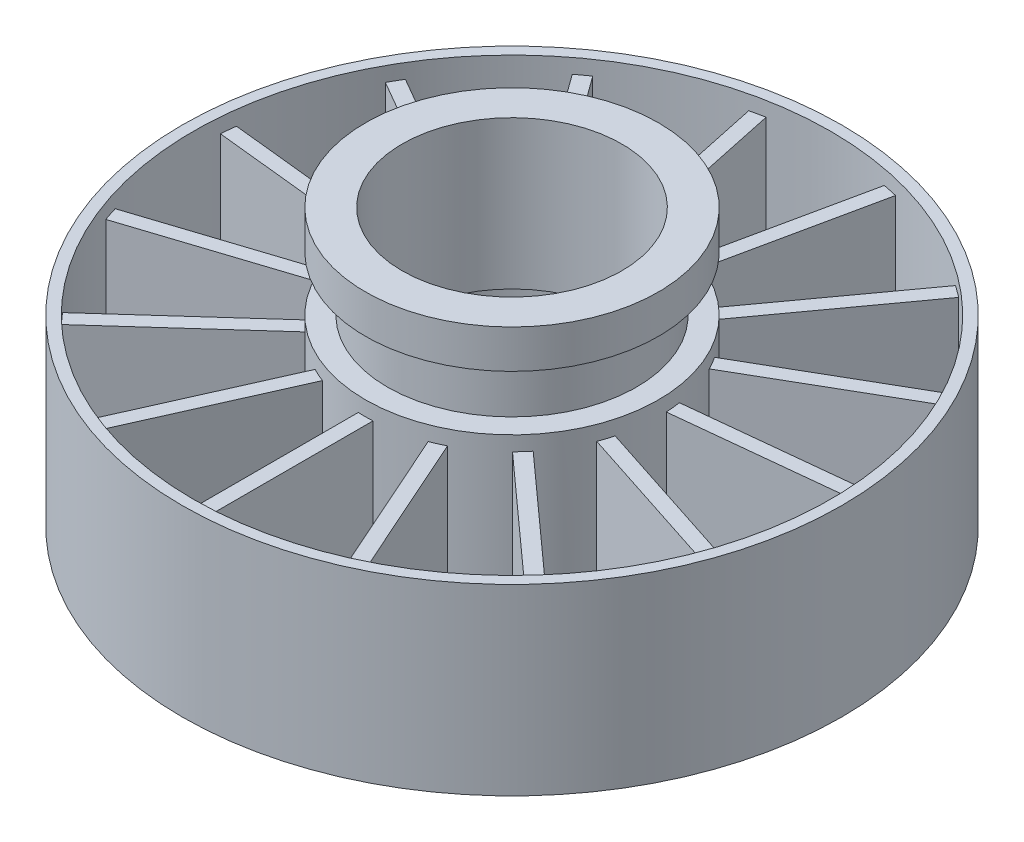
from build123d import *
from build123d.topology import SkipClean

# Parameters (mm, degrees)
SKETCH1_R                = 90
BOSS_EXTRUDE1_DEPTH      = 50
CUT_EXTRUDE1_DEPTH       = 50
SKETCH4_R                = 40
CUT_EXTRUDE2_DEPTH       = 137.546695512
SKETCH5_R                = 40
SKETCH5_R_2              = 34
BOSS_EXTRUDE2_DEPTH      = 50
BOSS_EXTRUDE3_DEPTH      = 15
BOSS_EXTRUDE3_DEPTH_BACK = 15
SKETCH9_R                = 34
SKETCH9_R_2              = 30
SKETCH10_R               = 40
SKETCH10_R_2             = 30
BOSS_EXTRUDE4_DEPTH      = 10.5
SKETCH11_R               = 90
SKETCH11_R_2             = 87
BOSS_EXTRUDE5_DEPTH      = 50
SKETCH12_R               = 87
SKETCH12_R_2             = 40
CUT_EXTRUDE3_DEPTH       = 4
SKETCH13_R               = 87
CUT_EXTRUDE4_DEPTH       = 4


with BuildPart() as part:
    # Sketch1 → Boss-Extrude1 (new body)
    with BuildSketch(Plane(origin=(0, 0, 0), x_dir=(1, 0, 0), z_dir=(0, 1, 0))):
        with Locations(Location((0, 0, 0), (0, 0, 270))):
            Circle(SKETCH1_R)
    extrude(amount=BOSS_EXTRUDE1_DEPTH)

    # Sketch2 → Cut-Extrude1 (cut)
    with BuildSketch(Plane.XZ):
        with BuildLine():
            Line((-2, 9.409260219), (-2, 89.977775034))
            ThreePointArc((-2, 89.977775034), (-18.712052174, 88.033284066), (-34.770167253, 83.012260957))
            Line((-34.770167253, 83.012260957), (-2, 9.409260219))
        make_face()
        with BuildLine():
            ThreePointArc((34.770167253, 83.012260957), (18.712052174, 88.033284066), (2, 89.977775034))
            Line((2, 89.977775034), (2, 9.409260219))
            Line((2, 9.409260219), (34.770167253, 83.012260957))
        make_face()
        with BuildLine():
            Line((-5.654181831, 7.782313647), (-38.424349084, 81.385314385))
            ThreePointArc((-38.424349084, 81.385314385), (-52.900672706, 72.811529494), (-65.528256711, 61.693172818))
            Line((-65.528256711, 61.693172818), (-5.654181831, 7.782313647))
        make_face()
        with BuildLine():
            ThreePointArc((65.528256711, 61.693172818), (52.900672706, 72.811529494), (38.424349084, 81.385314385))
            Line((38.424349084, 81.385314385), (5.654181831, 7.782313647))
            Line((5.654181831, 7.782313647), (65.528256711, 61.693172818))
        make_face()
        with BuildLine():
            Line((-8.330704256, 4.809734345), (-68.204779137, 58.720593516))
            ThreePointArc((-68.204779137, 58.720593516), (-77.942286341, 45), (-84.955915279, 29.706774634))
            Line((-84.955915279, 29.706774634), (-8.330704256, 4.809734345))
        make_face()
        with BuildLine():
            ThreePointArc((84.955915279, 29.706774634), (77.942286341, 45), (68.204779137, 58.720593516))
            Line((68.204779137, 58.720593516), (8.330704256, 4.809734345))
            Line((8.330704256, 4.809734345), (84.955915279, 29.706774634))
        make_face()
        with BuildLine():
            Line((-9.566772234, 1.00550828), (-86.191983256, 25.902548569))
            ThreePointArc((-86.191983256, 25.902548569), (-89.506970583, 9.407561694), (-89.693924294, -7.416194762))
            Line((-89.693924294, -7.416194762), (-9.566772234, 1.00550828))
        make_face()
        with BuildLine():
            ThreePointArc((89.693924294, -7.416194762), (89.506970583, 9.407561694), (86.191983256, 25.902548569))
            Line((86.191983256, 25.902548569), (9.566772234, 1.00550828))
            Line((9.566772234, 1.00550828), (89.693924294, -7.416194762))
        make_face()
        with BuildLine():
            Line((-9.14865838, -2.972579302), (-89.275810441, -11.394282343))
            ThreePointArc((-89.275810441, -11.394282343), (-85.595086467, -27.811529494), (-78.923038955, -43.256836709))
            Line((-78.923038955, -43.256836709), (-9.14865838, -2.972579302))
        make_face()
        with BuildLine():
            Line((89.275810441, -11.394282343), (9.14865838, -2.972579302))
            Line((9.14865838, -2.972579302), (78.923038955, -43.256836709))
            ThreePointArc((78.923038955, -43.256836709), (85.595086467, -27.811529494), (89.275810441, -11.394282343))
        make_face()
        with BuildLine():
            Line((-7.14865838, -6.436680917), (-76.923038955, -46.720938324))
            ThreePointArc((-76.923038955, -46.720938324), (-66.883034293, -60.221754572), (-54.505643188, -71.617978614))
            Line((-54.505643188, -71.617978614), (-7.14865838, -6.436680917))
        make_face()
        with BuildLine():
            Line((76.923038955, -46.720938324), (7.14865838, -6.436680917))
            Line((7.14865838, -6.436680917), (54.505643188, -71.617978614))
            ThreePointArc((54.505643188, -71.617978614), (66.883034293, -60.221754572), (76.923038955, -46.720938324))
        make_face()
        with BuildLine():
            Line((-3.912590403, -8.787821926), (-51.26957521, -73.969119623))
            ThreePointArc((-51.26957521, -73.969119623), (-36.606297877, -82.219091188), (-20.663726545, -87.595721387))
            Line((-20.663726545, -87.595721387), (-3.912590403, -8.787821926))
        make_face()
        with BuildLine():
            Line((51.26957521, -73.969119623), (3.912590403, -8.787821926))
            Line((3.912590403, -8.787821926), (20.663726545, -87.595721387))
            ThreePointArc((20.663726545, -87.595721387), (36.606297877, -82.219091188), (51.26957521, -73.969119623))
        make_face()
        with BuildLine():
            Line((0, -9.619468689), (-16.751136142, -88.42736815))
            ThreePointArc((-16.751136142, -88.42736815), (0, -90), (16.751136142, -88.42736815))
            Line((16.751136142, -88.42736815), (0, -9.619468689))
        make_face()
    extrude(amount=-CUT_EXTRUDE1_DEPTH, mode=Mode.SUBTRACT)

    # Sketch4 → Cut-Extrude2 (cut, through all)
    with BuildSketch(Plane(origin=(0, 50, 0), x_dir=(1, 0, 0), z_dir=(0, 1, 0))):
        Circle(SKETCH4_R)
    extrude(amount=-CUT_EXTRUDE2_DEPTH, mode=Mode.SUBTRACT)


with BuildPart() as cut_extrude2_piece_1:
    # of the separate pieces the step leaves, piece 1, a body of its own (cut_extrude2_pieces)
    add(part.part.solids().sort_by_distance((-84.955915279, 0, 29.706774634))[0])


with BuildPart() as cut_extrude2_piece_2:
    # of the separate pieces the step leaves, piece 2, a body of its own (cut_extrude2_pieces)
    add(part.part.solids().sort_by_distance((-65.528256711, 0, 61.693172818))[0])


with BuildPart() as cut_extrude2_piece_3:
    # of the separate pieces the step leaves, piece 3, a body of its own (cut_extrude2_pieces)
    add(part.part.solids().sort_by_distance((10.262360744, 0, -38.661142662))[0])


with BuildPart() as cut_extrude2_piece_4:
    # of the separate pieces the step leaves, piece 4, a body of its own (cut_extrude2_pieces)
    add(part.part.solids().sort_by_distance((14.422025249, 0, 37.309585735))[0])


with BuildPart() as cut_extrude2_piece_5:
    # of the separate pieces the step leaves, piece 5, a body of its own (cut_extrude2_pieces)
    add(part.part.solids().sort_by_distance((-2, 0, 89.977775034))[0])


with BuildPart() as cut_extrude2_piece_6:
    # of the separate pieces the step leaves, piece 6, a body of its own (cut_extrude2_pieces)
    add(part.part.solids().sort_by_distance((39.940175529, 0, -2.186865046))[0])


with BuildPart() as cut_extrude2_piece_7:
    # of the separate pieces the step leaves, piece 7, a body of its own (cut_extrude2_pieces)
    add(part.part.solids().sort_by_distance((25.100036427, 0, -31.144633107))[0])


with BuildPart() as cut_extrude2_piece_8:
    # of the separate pieces the step leaves, piece 8, a body of its own (cut_extrude2_pieces)
    add(part.part.solids().sort_by_distance((-34.770167253, 0, 83.012260957))[0])


with BuildPart() as cut_extrude2_piece_9:
    # of the separate pieces the step leaves, piece 9, a body of its own (cut_extrude2_pieces)
    add(part.part.solids().sort_by_distance((28.350351313, 0, 28.218036438))[0])


with BuildPart() as cut_extrude2_piece_10:
    # of the separate pieces the step leaves, piece 10, a body of its own (cut_extrude2_pieces)
    add(part.part.solids().sort_by_distance((-20.663726545, 0, -87.595721387))[0])


with BuildPart() as cut_extrude2_piece_11:
    # of the separate pieces the step leaves, piece 11, a body of its own (cut_extrude2_pieces)
    add(part.part.solids().sort_by_distance((-54.505643188, 0, -71.617978614))[0])


with BuildPart() as cut_extrude2_piece_12:
    # of the separate pieces the step leaves, piece 12, a body of its own (cut_extrude2_pieces)
    add(part.part.solids().sort_by_distance((37.37664408, 0, 14.247332289))[0])


with BuildPart() as cut_extrude2_piece_13:
    # of the separate pieces the step leaves, piece 13, a body of its own (cut_extrude2_pieces)
    add(part.part.solids().sort_by_distance((35.597687784, 0, -18.242933548))[0])


with BuildPart() as cut_extrude2_piece_14:
    # of the separate pieces the step leaves, piece 14, a body of its own (cut_extrude2_pieces)
    add(part.part.solids().sort_by_distance((-89.693924294, 0, -7.416194762))[0])


with BuildPart() as cut_extrude2_piece_15:
    # of the separate pieces the step leaves, piece 15, a body of its own (cut_extrude2_pieces)
    add(part.part.solids().sort_by_distance((-78.923038955, 0, -43.256836709))[0])


with BuildPart() as body_16:
    # Sketch5 → Boss-Extrude2 (new body)
    with BuildSketch(Plane(origin=(0, 50, 0), x_dir=(1, 0, 0), z_dir=(0, 1, 0))):
        with Locations(Location((0, 0, 0), (0, 0, 270))):
            Circle(SKETCH5_R)
        with Locations(Location((0, 0, 0), (0, 0, 270))):
            Circle(SKETCH5_R_2, mode=Mode.SUBTRACT)
    extrude(amount=-BOSS_EXTRUDE2_DEPTH)



with BuildPart() as body_17:
    # Sketch9 → Boss-Extrude3 (new, two sides: drawn at the far end of the back side and taken through both)
    with BuildSketch(Plane(origin=(0, 50, 0), x_dir=(1, 0, 0), z_dir=(0, 1, 0)).offset(-BOSS_EXTRUDE3_DEPTH_BACK)):
        with Locations(Location((0, 0, 0), (0, 0, 270))):
            Circle(SKETCH9_R)
        with Locations(Location((0, 0, 0), (0, 0, 270))):
            Circle(SKETCH9_R_2, mode=Mode.SUBTRACT)
    extrude(amount=BOSS_EXTRUDE3_DEPTH + BOSS_EXTRUDE3_DEPTH_BACK)

    # Sketch10 → Boss-Extrude4 (add)
    with BuildSketch(Plane(origin=(0, 65, 0), x_dir=(1, 0, 0), z_dir=(0, 1, 0))):
        with Locations(Location((0, 0, 0), (0, 0, 270))):
            Circle(SKETCH10_R)
        with Locations(Location((0, 0, 0), (0, 0, 270))):
            Circle(SKETCH10_R_2, mode=Mode.SUBTRACT)
    extrude(amount=BOSS_EXTRUDE4_DEPTH)


with BuildPart() as body_16_1:
    add(body_16.part)

    add(body_17.part)  # Boss-Extrude5 merges body 17

    add(cut_extrude2_piece_3.part)  # Boss-Extrude5 merges Cut-Extrude2 piece 3

    add(cut_extrude2_piece_7.part)  # Boss-Extrude5 merges Cut-Extrude2 piece 7

    add(cut_extrude2_piece_14.part)  # Boss-Extrude5 merges Cut-Extrude2 piece 14

    add(cut_extrude2_piece_15.part)  # Boss-Extrude5 merges Cut-Extrude2 piece 15

    add(cut_extrude2_piece_11.part)  # Boss-Extrude5 merges Cut-Extrude2 piece 11

    add(cut_extrude2_piece_5.part)  # Boss-Extrude5 merges Cut-Extrude2 piece 5

    add(cut_extrude2_piece_1.part)  # Boss-Extrude5 merges Cut-Extrude2 piece 1

    add(cut_extrude2_piece_8.part)  # Boss-Extrude5 merges Cut-Extrude2 piece 8

    add(cut_extrude2_piece_2.part)  # Boss-Extrude5 merges Cut-Extrude2 piece 2

    add(cut_extrude2_piece_13.part)  # Boss-Extrude5 merges Cut-Extrude2 piece 13

    add(cut_extrude2_piece_6.part)  # Boss-Extrude5 merges Cut-Extrude2 piece 6

    add(cut_extrude2_piece_4.part)  # Boss-Extrude5 merges Cut-Extrude2 piece 4

    add(cut_extrude2_piece_12.part)  # Boss-Extrude5 merges Cut-Extrude2 piece 12

    add(cut_extrude2_piece_9.part)  # Boss-Extrude5 merges Cut-Extrude2 piece 9

    add(cut_extrude2_piece_10.part)  # Boss-Extrude5 merges Cut-Extrude2 piece 10
    # Sketch11 → Boss-Extrude5 (add)
    with BuildSketch(Plane.XZ):
        with Locations(Location((0, 0, 0), (0, 0, 90))):
            Circle(SKETCH11_R)
        Circle(SKETCH11_R_2, mode=Mode.SUBTRACT)
    extrude(amount=-BOSS_EXTRUDE5_DEPTH)

    # Sketch12 → Cut-Extrude3 (cut)
    with SkipClean():  # the faces are left unmerged after this step: merging them gives an invalid solid
        with BuildSketch(Plane(origin=(0, 50, 0), x_dir=(1, 0, 0), z_dir=(0, 1, 0))):
            with Locations(Location((0, 0, 0), (0, 0, 100.682739604))):
                Circle(SKETCH12_R)
            with Locations(Location((0, 0, 0), (0, 0, 270))):
                Circle(SKETCH12_R_2, mode=Mode.SUBTRACT)
        extrude(amount=-CUT_EXTRUDE3_DEPTH, mode=Mode.SUBTRACT)
    add(body_16_1.part.scale(1), mode=Mode.REPLACE)  # the faces are merged on a copy

    # Sketch13 → Cut-Extrude4 (cut)
    with SkipClean():  # the faces are left unmerged after this step: merging them gives an invalid solid
        with BuildSketch(Plane.XZ):
            with Locations(Location((0, 0, 0), (0, 0, 270))):
                Circle(SKETCH13_R)
        extrude(amount=-CUT_EXTRUDE4_DEPTH, mode=Mode.SUBTRACT)


solid = body_16_1.part
